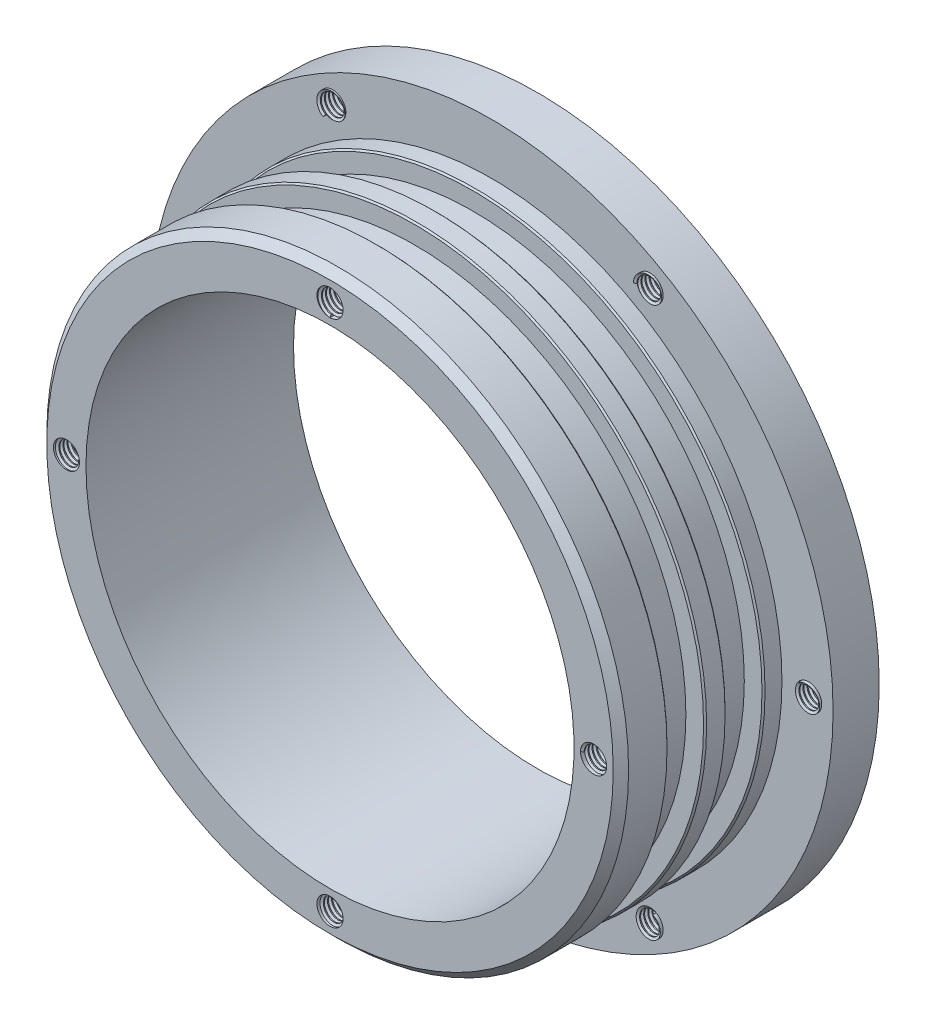
from build123d import *
from build123d.topology import SkipClean

# Parameters (mm, degrees)
SKETCH2_R                = 31.75
CUT_EXTRUDE1_DEPTH       = 69.414947197
SKETCH3_R                = 38.1
SKETCH3_R_2              = 35.56
CUT_EXTRUDE2_DEPTH       = 2.286
THREAD1_PITCH            = 0.529166667
CIRPATTERN1_COUNT        = 6
M3_CLEARANCE_HOLE4_D     = 3.4
M3_CLEARANCE_HOLE4_DEPTH = 5.08
M3_CLEARANCE_HOLE4_TIP   = 1.021463052
THREAD2_PITCH            = 0.529166667
CIRPATTERN2_COUNT        = 4


with BuildPart() as part:
    # Sketch1 → Revolve1 (revolve)
    with BuildSketch(Plane(origin=(0, 0, 0), x_dir=(1, 0, 0), z_dir=(0, 1, 0))):
        Polygon((37.8, 21), (44.45, 21), (44.45, 27), (0, 27), (0, 0), (36.846, 0), (37.846, 1), (37.846, 6), (37.646, 6.2), (35.3, 6.2), (35.3, 11), (37.6, 11), (37.8, 11.2), (37.8, 13.6), (37.6, 13.8), (35.3, 13.8), (35.3, 18.6), (37.6, 18.6), (37.8, 18.8), align=None)
    revolve(axis=Axis((0, 0, 0), (0, 0, -1)))

    # Sketch2 → Cut-Extrude1 (cut, through all)
    with BuildSketch(Plane(origin=(0, 0, -27), x_dir=(-1, 0, 0), z_dir=(0, 0, -1))):
        Circle(SKETCH2_R)
    extrude(amount=-CUT_EXTRUDE1_DEPTH, mode=Mode.SUBTRACT)

    # Sketch3 → Cut-Extrude2 (cut)
    with BuildSketch(Plane(origin=(0, 0, -27), x_dir=(-1, 0, 0), z_dir=(0, 0, -1))):
        Circle(SKETCH3_R)
        Circle(SKETCH3_R_2, mode=Mode.SUBTRACT)
    extrude(amount=-CUT_EXTRUDE2_DEPTH, mode=Mode.SUBTRACT)

    # Sketch9 → M3 Clearance Hole3 (revolve, cut)
    with BuildSketch(Plane(origin=(41.275, 0, -27), x_dir=(0, 1, 0), z_dir=(1, 0, 0))):
        Polygon((0, 0), (0, 13.721463052), (1.7, 12.7), (1.7, 0), align=None)
    m3_clearance_hole3 = revolve(axis=Axis((41.275, 0, -33.35), (0, 0, 1)), mode=Mode.SUBTRACT)

    # Thread1: arcs per turn and ends read off the stored shape
    # Thread1: the profile of Thread Profile1 profile screwed along a right-hand helix through 11.338583 turns, 6 arcs to a turn; built about Z, then put on its axis
    thread1_z = Axis((0, 0, 0), (0, 0, 1))
    thread1_corners = [(1.7003, 0, -0.000173205), (1.7003, 0, 0.463194037), (1.413580141, 0, 0.297656249), (1.413580141, 0, 0.165364583)]
    with BuildLine(mode=Mode.PRIVATE) as thread1_profile:
        Line(thread1_corners[0], thread1_corners[1])
        Line(thread1_corners[1], thread1_corners[2])
        Line(thread1_corners[2], thread1_corners[3])
        Line(thread1_corners[3], thread1_corners[0])
    thread1_cap = Face(thread1_profile.wire())
    thread1_turn_angles = [0, 30, 60, 90, 120, 150, 180, 210, 240, 270, 300, 330, 360]
    thread1_turn_weights = [1, 0.8660254037844387, 1, 0.8660254037844387, 1, 0.8660254037844387, 1, 0.8660254037844387, 1, 0.8660254037844387, 1, 0.8660254037844387, 1]
    thread1_turn_rails = [Edge.make_bspline([Vector(p[0], p[1], 0).rotate(thread1_z, thread1_turn_angles[k]) / thread1_turn_weights[k] + Vector(0, 0, p[2] + THREAD1_PITCH * thread1_turn_angles[k] / 360) for k in range(13)], [0, 0, 0, 1, 1, 2, 2, 3, 3, 4, 4, 5, 5, 6, 6, 6], 2, thread1_turn_weights) for p in thread1_corners]
    thread1_turn_sides = [Face.make_surface_from_curves(thread1_turn_rails[p[0]], thread1_turn_rails[p[1]]) for p in [(0, 1), (1, 2), (2, 3), (3, 0)]]
    thread1_last_angles = [3960, 3990, 4020, 4050, 4080, 4080.94488189, 4081.88976378]
    thread1_last_weights = [1, 0.8660254037844387, 1, 0.8660254037844387, 1, 0.9998640215936442, 1]
    thread1_last_rails = [Edge.make_bspline([Vector(p[0], p[1], 0).rotate(thread1_z, thread1_last_angles[k]) / thread1_last_weights[k] + Vector(0, 0, p[2] + THREAD1_PITCH * thread1_last_angles[k] / 360) for k in range(7)], [0, 0, 0, 1, 1, 2, 2, 3, 3, 3], 2, thread1_last_weights) for p in thread1_corners]
    thread1_last_sides = [Face.make_surface_from_curves(thread1_last_rails[p[0]], thread1_last_rails[p[1]]) for p in [(0, 1), (1, 2), (2, 3), (3, 0)]]
    thread1 = Plane(origin=(41.275, 0, -27), x_dir=(1, 0, 0), z_dir=(0, 0, 1)) * Solid(Shell([*[p.moved(Location((0, 0, THREAD1_PITCH * i))) for i in range(11) for p in thread1_turn_sides], *thread1_last_sides, thread1_cap, thread1_cap.rotate(thread1_z, 4081.88976378).moved(Location((0, 0, THREAD1_PITCH * 4081.88976378 / 360)))]))
    add(thread1)

    # CirPattern1: M3 Clearance Hole3, Thread1 ×6 about axis
    cirpattern1_axis = Axis((0, 0, -27), (0, 0, 1))
    add([m3_clearance_hole3.rotate(cirpattern1_axis, i * 360 / CIRPATTERN1_COUNT) for i in range(1, CIRPATTERN1_COUNT)], mode=Mode.SUBTRACT)
    add([thread1.rotate(cirpattern1_axis, i * 360 / CIRPATTERN1_COUNT) for i in range(1, CIRPATTERN1_COUNT)])

    # M3 Clearance Hole4
    with Locations(Plane.XY):
        with Locations((0, 34.29), (34.29, 0), (0, -34.29), (-34.29, 0)):
            Hole(M3_CLEARANCE_HOLE4_D / 2, depth=M3_CLEARANCE_HOLE4_DEPTH)
            with Locations((0, 0, -(M3_CLEARANCE_HOLE4_DEPTH + M3_CLEARANCE_HOLE4_TIP / 2))):  # 118° drill point
                Cone(0, M3_CLEARANCE_HOLE4_D / 2, M3_CLEARANCE_HOLE4_TIP, mode=Mode.SUBTRACT)

    # Thread2: arcs per turn and ends read off the stored shape
    # Thread2: the profile of Thread Profile2 profile screwed along a right-hand helix through 9.6 turns, 6 arcs to a turn; built about Z, then put on its axis
    thread2_z = Axis((0, 0, 0), (0, 0, 1))
    thread2_corners = [(1.7003, 0, -0.000173205), (1.7003, 0, 0.463194037), (1.413580141, 0, 0.297656249), (1.413580141, 0, 0.165364583)]
    with BuildLine(mode=Mode.PRIVATE) as thread2_profile:
        Line(thread2_corners[0], thread2_corners[1])
        Line(thread2_corners[1], thread2_corners[2])
        Line(thread2_corners[2], thread2_corners[3])
        Line(thread2_corners[3], thread2_corners[0])
    thread2_cap = Face(thread2_profile.wire())
    thread2_turn_angles = [0, 30, 60, 90, 120, 150, 180, 210, 240, 270, 300, 330, 360]
    thread2_turn_weights = [1, 0.8660254037844387, 1, 0.8660254037844387, 1, 0.8660254037844387, 1, 0.8660254037844387, 1, 0.8660254037844387, 1, 0.8660254037844387, 1]
    thread2_turn_rails = [Edge.make_bspline([Vector(p[0], p[1], 0).rotate(thread2_z, thread2_turn_angles[k]) / thread2_turn_weights[k] + Vector(0, 0, p[2] + THREAD2_PITCH * thread2_turn_angles[k] / 360) for k in range(13)], [0, 0, 0, 1, 1, 2, 2, 3, 3, 4, 4, 5, 5, 6, 6, 6], 2, thread2_turn_weights) for p in thread2_corners]
    thread2_turn_sides = [Face.make_surface_from_curves(thread2_turn_rails[p[0]], thread2_turn_rails[p[1]]) for p in [(0, 1), (1, 2), (2, 3), (3, 0)]]
    thread2_last_angles = [3240, 3270, 3300, 3330, 3360, 3390, 3420, 3438, 3456]
    thread2_last_weights = [1, 0.8660254037844387, 1, 0.8660254037844387, 1, 0.8660254037844387, 1, 0.9510565162951499, 1]
    thread2_last_rails = [Edge.make_bspline([Vector(p[0], p[1], 0).rotate(thread2_z, thread2_last_angles[k]) / thread2_last_weights[k] + Vector(0, 0, p[2] + THREAD2_PITCH * thread2_last_angles[k] / 360) for k in range(9)], [0, 0, 0, 1, 1, 2, 2, 3, 3, 4, 4, 4], 2, thread2_last_weights) for p in thread2_corners]
    thread2_last_sides = [Face.make_surface_from_curves(thread2_last_rails[p[0]], thread2_last_rails[p[1]]) for p in [(0, 1), (1, 2), (2, 3), (3, 0)]]
    thread2 = Plane(origin=(34.29, 0, 0), x_dir=(-1, 0, 0), z_dir=(0, 0, -1)) * Solid(Shell([*[p.moved(Location((0, 0, THREAD2_PITCH * i))) for i in range(9) for p in thread2_turn_sides], *thread2_last_sides, thread2_cap, thread2_cap.rotate(thread2_z, 3456).moved(Location((0, 0, THREAD2_PITCH * 3456 / 360)))]))
    add(thread2)

    # CirPattern2: Thread2 ×4 about axis
    with SkipClean():  # the faces are left unmerged after this step: merging them gives an invalid solid
        cirpattern2_axis = Axis((0, 0, 0), (0, 0, 1))
        for i in range(1, CIRPATTERN2_COUNT):
            add(thread2.rotate(cirpattern2_axis, i * 360 / CIRPATTERN2_COUNT))


solid = part.part
